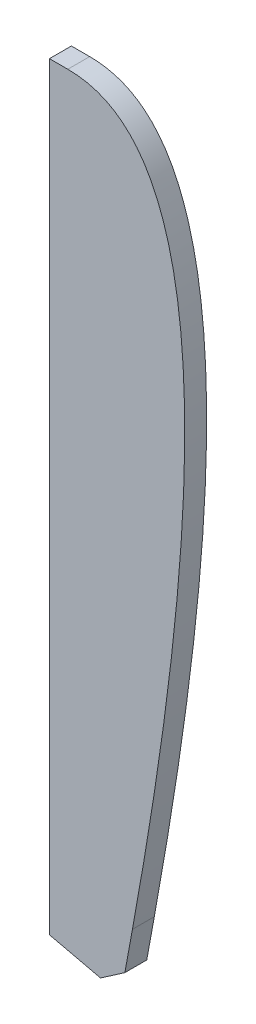
from build123d import *

# Parameters (mm, degrees)
BOSS_EXTRUDE1_DEPTH = 12.7
CHAMFER1_SIZE       = 12.7
CHAMFER1_SIZE2      = 12.14102868
HOLE1_D             = 3.175
HOLE1_DEPTH         = 50.8
HOLE1_CSINK_D       = 10.16
HOLE1_CSINK_ANGLE   = 82
HOLE1_TIP           = 0.953866233


with BuildPart() as part:
    # Sketch2 → Boss-Extrude1 (new body)
    with BuildSketch(Plane.XY):
        Polygon((12.7, -5480.416534997), (54.140557785, -5490.047588702), (136.525, -5040.331407449), (12.7, -5040.331407449), align=None)
    extrude(amount=-BOSS_EXTRUDE1_DEPTH)

    # Fillet1
    # a fillet whose section is not a circle: 406.4, 38.1 mm, written as the material it takes off along each edge
    with BuildSketch(Plane(origin=(136.525, -5040.331407449, 1050.356508865), x_dir=(-0.18019344316526936, -0.9836311925921447, 0), z_dir=(0, 0, -1))) as fillet1_piece_1:
        with BuildLine():
            Bezier((420.142603546, 0), (0, 0), (20.394886876, 111.330615302), weights=[1, 1, 1])
            Line((20.394886876, 111.330615302), (0, 0))
            Line((0, 0), (420.142603546, 0))
        make_face()
    extrude(amount=2113.413017729, mode=Mode.SUBTRACT)

    # Chamfer1
    chamfer1_edges = [part.edges().sort_by_distance(p)[0] for p in [
        (54.140557785, -5490.047588702, -6.35),
    ]]
    chamfer1_side = [part.faces().sort_by_distance(p)[0] for p in [
        (57.479307716, -5471.822183168, -6.35),
    ]]
    chamfer(chamfer1_edges, length=CHAMFER1_SIZE, length2=CHAMFER1_SIZE2, reference=chamfer1_side[0])

    # Hole1
    with Locations(Plane(origin=(-19.05, -5578.323279584, -94.73946), x_dir=(0, 0, 1), z_dir=(-1, 0, 0))):
        with Locations((218.563766336, 102.817509219), (218.563766336, 48.504773219), (202.68946, 123.306744588), (202.68946, 317.949308361), (202.68946, 518.941872135), (88.38946, 518.941872135), (88.38946, 317.949308361), (88.38946, 123.306744588), (104.263766336, 216.849631358), (104.263766336, 132.677202288), (104.263766336, 48.504773219), (-104.263766336, 48.504773219), (-104.263766336, 132.677202288), (-104.263766336, 216.849631358), (-88.38946, 123.306744588), (-88.38946, 317.949308361), (-88.38946, 518.941872135), (-202.68946, 518.941872135), (-202.68946, 317.949308361), (-202.68946, 123.306744588), (-218.563766336, 48.504773219), (-218.563766336, 102.817509219)):
            CounterSinkHole(HOLE1_D / 2, HOLE1_CSINK_D / 2, depth=HOLE1_DEPTH, counter_sink_angle=HOLE1_CSINK_ANGLE)
            with Locations((0, 0, -(HOLE1_DEPTH + HOLE1_TIP / 2))):  # 118° drill point
                Cone(0, HOLE1_D / 2, HOLE1_TIP, mode=Mode.SUBTRACT)


solid = part.part
